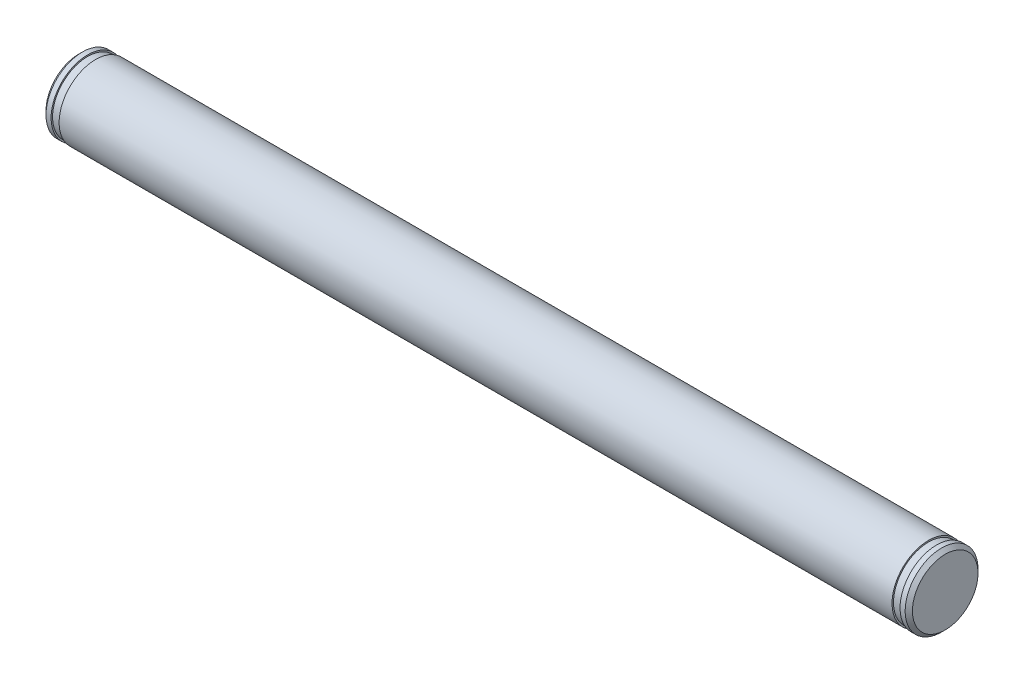
from build123d import *

# Parameters (mm, degrees)
CHAMFER_1_SIZE = 0.5


with BuildPart() as part:
    # 草图1 → 旋转1 (revolve)
    with BuildSketch(Plane.XY):
        Polygon((59.45, 0), (59.45, 5), (58.25, 5), (58.25, 4.8), (57.15, 4.8), (57.15, 5), (-57.15, 5), (-57.15, 4.8), (-58.25, 4.8), (-58.25, 5), (-59.45, 5), (-59.45, 0), align=None)
    revolve(axis=Axis((59.45, 0, 0), (-1, 0, 0)))

    # 倒角1
    chamfer_1_edges = [part.edges().sort_by_distance(p)[0] for p in [
        (59.45, -5, 0),
        (-59.45, -5, 0),
    ]]
    chamfer(chamfer_1_edges, length=CHAMFER_1_SIZE)


solid = part.part
